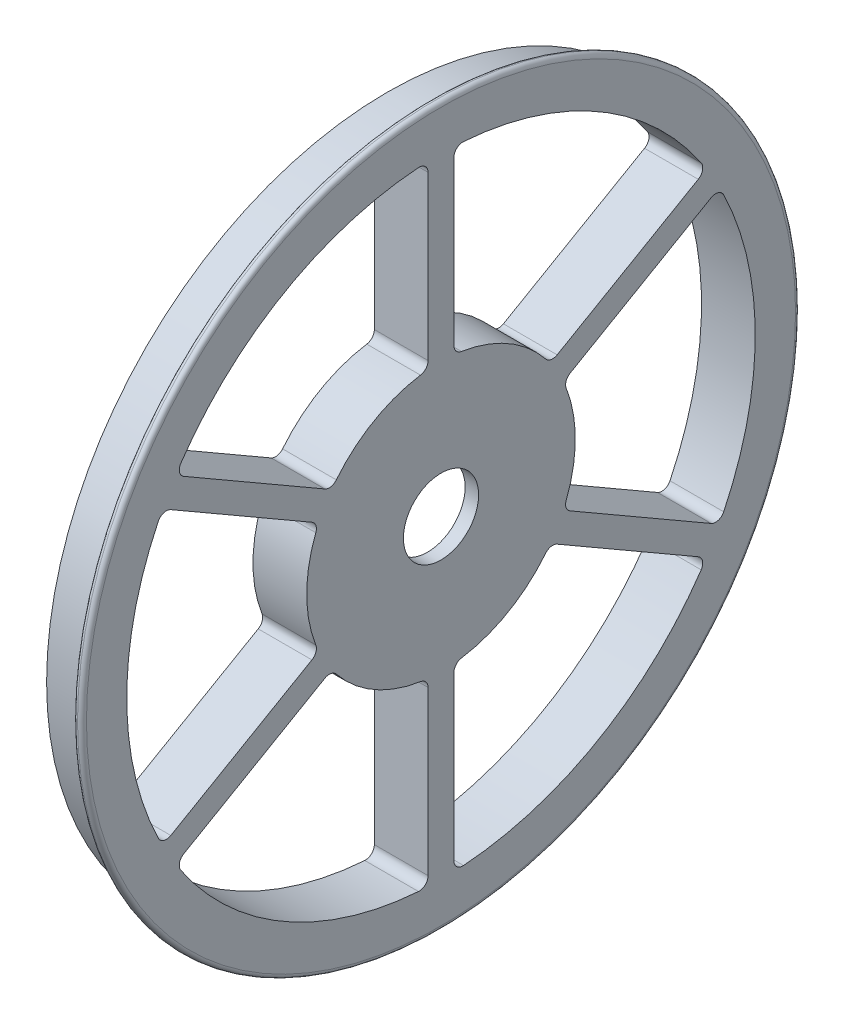
from build123d import *

# Parameters (mm, degrees)
CUT_EXTRUDE2_DEPTH      = 58.026485075
FILLET1_R               = 0.5
CUT_EXTRUDE5_DEPTH      = 58.026485145
CUT_EXTRUDE5_DEPTH_BACK = 58.026485145
SKETCH7_R               = 4.2
SKETCH8_R               = 11.25
CUT_EXTRUDE6_DEPTH      = 4.5


with BuildPart() as part:
    # Sketch1 → Revolve2 (revolve)
    with BuildSketch(Plane.XY, mode=Mode.PRIVATE) as revolve2_sk:
        Polygon((-3, 0), (-3, 38.05), (2, 38.05), (2, 40.1), (3, 40.1), (3, 0), align=None)
    revolve(revolve2_sk.sketch.rotate(Axis((3, 0, 0), (-1, 0, 0)), 90), axis=Axis((3, 0, 0), (-1, 0, 0)))

    # Sketch2 → Cut-Extrude2 (cut, through all)
    with BuildSketch(Plane.ZY.offset(-3)):
        with BuildLine():
            Line((14.415571014, 6.656167139), (30.177246505, 15.756174727))
            ThreePointArc((30.177246505, 15.756174727), (30.970527299, 15.84617567), (31.576872502, 15.326810593))
            ThreePointArc((31.576872502, 15.326810593), (35.1, 0), (31.576872502, -15.326810593))
            ThreePointArc((31.576872502, -15.326810593), (30.970527299, -15.84617567), (30.177246505, -15.756174727))
            Line((30.177246505, -15.756174727), (14.415571014, -6.656167139))
            ThreePointArc((14.415571014, -6.656167139), (13.972302174, -6.122171697), (13.983347826, -5.428257877))
            ThreePointArc((13.983347826, -5.428257877), (15, 0), (13.983347826, 5.428257877))
            ThreePointArc((13.983347826, 5.428257877), (13.972302174, 6.122171697), (14.415571014, 6.656167139))
        make_face()
        with BuildLine():
            Line((12.972195341, -9.156167139), (28.733870832, -18.256174727))
            ThreePointArc((28.733870832, -18.256174727), (29.208454332, -18.898175575), (29.061843584, -19.682968463))
            ThreePointArc((29.061843584, -19.682968463), (17.55, -30.397491673), (2.515028919, -35.009779056))
            ThreePointArc((2.515028919, -35.009779056), (1.762072967, -34.744351245), (1.443375673, -34.012349453))
            Line((1.443375673, -34.012349453), (1.443375673, -15.812334278))
            ThreePointArc((1.443375673, -15.812334278), (1.684194871, -15.161454481), (2.290664693, -14.824063386))
            ThreePointArc((2.290664693, -14.824063386), (7.5, -12.990381057), (11.692683133, -9.395805509))
            ThreePointArc((11.692683133, -9.395805509), (12.288107303, -9.039282784), (12.972195341, -9.156167139))
        make_face()
        with BuildLine():
            Line((-1.443375673, -15.812334278), (-1.443375673, -34.012349453))
            ThreePointArc((-1.443375673, -34.012349453), (-1.762072967, -34.744351245), (-2.515028919, -35.009779056))
            ThreePointArc((-2.515028919, -35.009779056), (-17.55, -30.397491673), (-29.061843584, -19.682968463))
            ThreePointArc((-29.061843584, -19.682968463), (-29.208454332, -18.898175575), (-28.733870832, -18.256174727))
            Line((-28.733870832, -18.256174727), (-12.972195341, -9.156167139))
            ThreePointArc((-12.972195341, -9.156167139), (-12.288107303, -9.039282784), (-11.692683133, -9.395805509))
            ThreePointArc((-11.692683133, -9.395805509), (-7.5, -12.990381057), (-2.290664693, -14.824063386))
            ThreePointArc((-2.290664693, -14.824063386), (-1.684194871, -15.161454481), (-1.443375673, -15.812334278))
        make_face()
        with BuildLine():
            Line((-14.415571014, -6.656167139), (-30.177246505, -15.756174727))
            ThreePointArc((-30.177246505, -15.756174727), (-30.970527299, -15.84617567), (-31.576872502, -15.326810593))
            ThreePointArc((-31.576872502, -15.326810593), (-35.1, 0), (-31.576872502, 15.326810593))
            ThreePointArc((-31.576872502, 15.326810593), (-30.970527299, 15.84617567), (-30.177246505, 15.756174727))
            Line((-30.177246505, 15.756174727), (-14.415571014, 6.656167139))
            ThreePointArc((-14.415571014, 6.656167139), (-13.972302174, 6.122171697), (-13.983347826, 5.428257877))
            ThreePointArc((-13.983347826, 5.428257877), (-15, 0), (-13.983347826, -5.428257877))
            ThreePointArc((-13.983347826, -5.428257877), (-13.972302174, -6.122171697), (-14.415571014, -6.656167139))
        make_face()
        with BuildLine():
            Line((-12.972195341, 9.156167139), (-28.733870832, 18.256174727))
            ThreePointArc((-28.733870832, 18.256174727), (-29.208454332, 18.898175575), (-29.061843584, 19.682968463))
            ThreePointArc((-29.061843584, 19.682968463), (-17.55, 30.397491673), (-2.515028919, 35.009779056))
            ThreePointArc((-2.515028919, 35.009779056), (-1.762072967, 34.744351245), (-1.443375673, 34.012349453))
            Line((-1.443375673, 34.012349453), (-1.443375673, 15.812334278))
            ThreePointArc((-1.443375673, 15.812334278), (-1.684194871, 15.161454481), (-2.290664693, 14.824063386))
            ThreePointArc((-2.290664693, 14.824063386), (-7.5, 12.990381057), (-11.692683133, 9.395805509))
            ThreePointArc((-11.692683133, 9.395805509), (-12.288107303, 9.039282784), (-12.972195341, 9.156167139))
        make_face()
        with BuildLine():
            Line((1.443375673, 15.812334278), (1.443375673, 34.012349453))
            ThreePointArc((1.443375673, 34.012349453), (1.762072967, 34.744351245), (2.515028919, 35.009779056))
            ThreePointArc((2.515028919, 35.009779056), (17.55, 30.397491673), (29.061843584, 19.682968463))
            ThreePointArc((29.061843584, 19.682968463), (29.208454332, 18.898175575), (28.733870832, 18.256174727))
            Line((28.733870832, 18.256174727), (12.972195341, 9.156167139))
            ThreePointArc((12.972195341, 9.156167139), (12.288107303, 9.039282784), (11.692683133, 9.395805509))
            ThreePointArc((11.692683133, 9.395805509), (7.5, 12.990381057), (2.290664693, 14.824063386))
            ThreePointArc((2.290664693, 14.824063386), (1.684194871, 15.161454481), (1.443375673, 15.812334278))
        make_face()
    extrude(amount=CUT_EXTRUDE2_DEPTH, mode=Mode.SUBTRACT)

    # Fillet1
    fillet1_edges = [part.edges().sort_by_distance(p)[0] for p in [
        (3, 0, 40.1),
        (2, 0, 40.1),
        (2, 0, 38.05),
    ]]
    fillet(fillet1_edges, radius=FILLET1_R - 0.0001)  # a hair under: the kernel refuses the full size

    # Sketch7 → Cut-Extrude5 (cut, two sides: drawn at the far end of the back side and taken through both)
    with BuildSketch(Plane(origin=(3, 0, 0), x_dir=(0, 0, -1), z_dir=(1, 0, 0)).offset(-CUT_EXTRUDE5_DEPTH_BACK)):
        Circle(SKETCH7_R)
    extrude(amount=CUT_EXTRUDE5_DEPTH + CUT_EXTRUDE5_DEPTH_BACK, mode=Mode.SUBTRACT)

    # Sketch8 → Cut-Extrude6 (cut)
    with BuildSketch(Plane(origin=(-3, 0, 0), x_dir=(0, 0, -1), z_dir=(1, 0, 0))):
        with Locations(Location((0, 0, 0), (0, 0, 90))):
            Circle(SKETCH8_R)
    extrude(amount=CUT_EXTRUDE6_DEPTH, mode=Mode.SUBTRACT)


solid = part.part
